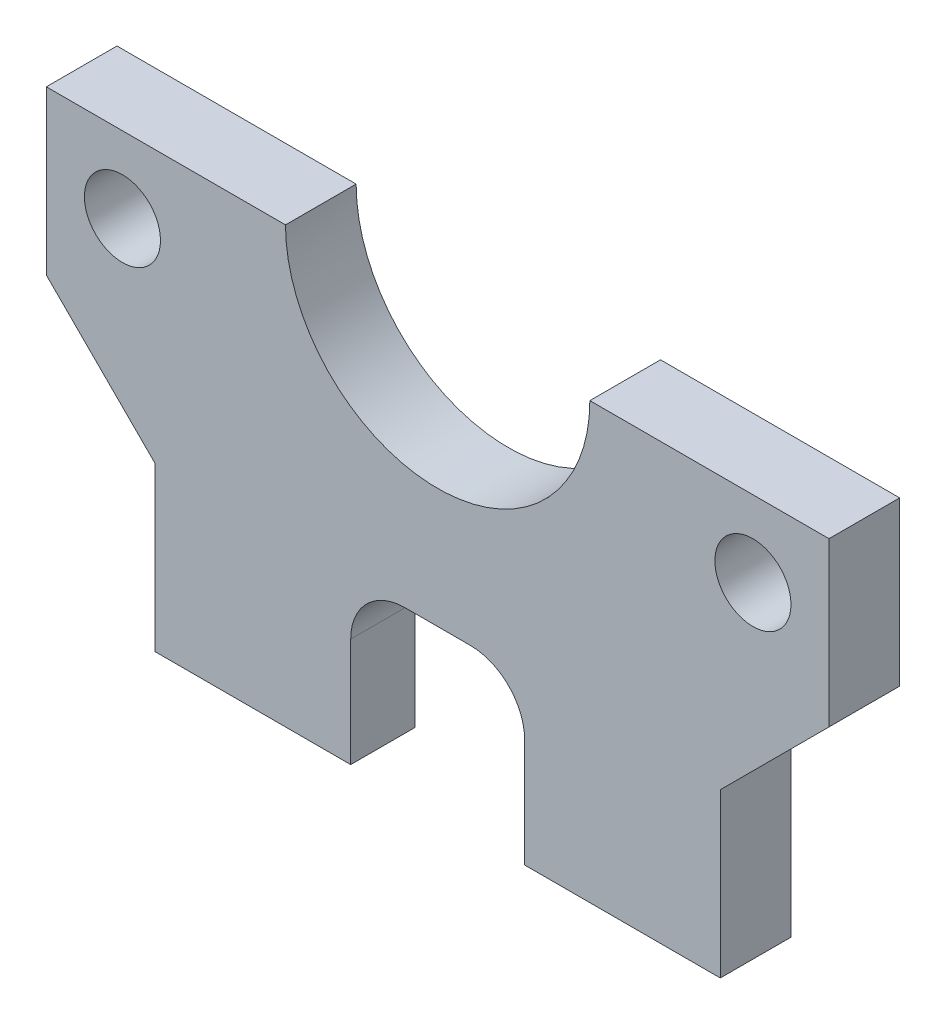
from build123d import *

# Parameters (mm, degrees)
SKETCH1_W           = 52
SKETCH1_H           = 40
BOSS_EXTRUDE1_DEPTH = 6.5
SKETCH10_W          = 10
SKETCH10_H          = 15
BOSS_EXTRUDE2_DEPTH = 6.5
CHAMFER1_SIZE       = 10
CUT_EXTRUDE4_DEPTH  = 25
SKETCH6_R           = 14
CUT_EXTRUDE5_DEPTH  = 10
SKETCH7_R           = 3.5
CUT_EXTRUDE6_DEPTH  = 10
SKETCH8_W           = 0.314102564
SKETCH8_H           = 2.557692308
CUT_EXTRUDE7_DEPTH  = 1
SKETCH9_W           = 16
SKETCH9_H           = 15
CUT_EXTRUDE8_DEPTH  = 10
FILLET1_R           = 5
CUT_EXTRUDE9_DEPTH  = 25


with BuildPart() as part:
    # Sketch1 → Boss-Extrude1 (new body)
    with BuildSketch(Plane.XY):
        Rectangle(SKETCH1_W, SKETCH1_H)
    extrude(amount=BOSS_EXTRUDE1_DEPTH)

    # Sketch10 → Boss-Extrude2 (add)
    with BuildSketch(Plane(origin=(0, 0, 0), x_dir=(-1, 0, 0), z_dir=(0, 0, -1))):
        with Locations((31, 12.5)):
            Rectangle(SKETCH10_W, SKETCH10_H)
        with Locations((-31, 12.5)):
            Rectangle(SKETCH10_W, SKETCH10_H)
    extrude(amount=-BOSS_EXTRUDE2_DEPTH)

    # Chamfer1
    chamfer1_edges = [part.edges().sort_by_distance(p)[0] for p in [
        (26, 5, 3.25),
        (-26, 5, 3.25),
    ]]
    chamfer(chamfer1_edges, length=CHAMFER1_SIZE - 0.0001)  # a hair under: the kernel refuses the full size

    # Sketch5 → Cut-Extrude4 (cut)
    with BuildSketch(Plane.XZ.offset(20)):
        Polygon((-26, 0), (26, 0), (-26, 0.925820442), align=None)
    extrude(amount=-CUT_EXTRUDE4_DEPTH, mode=Mode.SUBTRACT)

    # Sketch6 → Cut-Extrude5 (cut)
    with BuildSketch(Plane.XY.offset(6.5)):
        with Locations((0, 20)):
            Circle(SKETCH6_R)
    extrude(amount=-CUT_EXTRUDE5_DEPTH, mode=Mode.SUBTRACT)

    # Sketch7 → Cut-Extrude6 (cut)
    with BuildSketch(Plane.XY.offset(6.5)):
        with Locations((29, 13)):
            Circle(SKETCH7_R)
        with Locations((-29, 13)):
            Circle(SKETCH7_R)
    extrude(amount=-CUT_EXTRUDE6_DEPTH, mode=Mode.SUBTRACT)

    # Sketch8 → Cut-Extrude7 (cut)
    # profile 1 of 6: a face of its own
    with BuildSketch(Plane.XZ.offset(20)):
        with BuildLine():
            Line((13.448717949, 5.5), (14.149138622, 5.5))
            add(Edge.make_bspline(
                [(14.149138622, 5.5), (14.19587975, 5.499844414), (14.285627895, 5.499545672), (14.414201165, 5.497879909), (14.531028262, 5.493105553), (14.636048101, 5.48899697), (14.729258756, 5.481505028), (14.810946047, 5.474344381), (14.880733745, 5.46497072), (14.922979596, 5.456265297), (14.942107372, 5.452323718)],
                knots=[0, 0, 0, 0, 1.410062039, 2.707475311, 3.878576406, 4.937260626, 5.877586885, 6.699081471, 7.410979367, 8, 8, 8, 8], degree=3))
            add(Edge.make_bspline(
                [(14.942107372, 5.452323718), (14.967713996, 5.445996953), (15.018380985, 5.433478389), (15.091331051, 5.407018788), (15.160845375, 5.376399163), (15.2266352, 5.340435443), (15.288370991, 5.298860663), (15.346689302, 5.252392541), (15.401854765, 5.201285335), (15.451636395, 5.144250494), (15.498575447, 5.084413984), (15.538164073, 5.019710227), (15.572290553, 4.9520487), (15.59946107, 4.880741282), (15.621339044, 4.80647951), (15.636765283, 4.728590713), (15.646016471, 4.647429738), (15.646958326, 4.59207183), (15.647435897, 4.564002404)],
                knots=[0, 0, 0, 0, 1.027469482, 2.033020251, 3.019912614, 3.986113645, 4.951240523, 5.91722682, 6.890402269, 7.87763091, 8.8651537, 9.85103654, 10.82876324, 11.815024772, 12.821070561, 13.842952187, 14.906261191, 16, 16, 16, 16], degree=3))
            add(Edge.make_bspline(
                [(15.647435897, 4.564002404), (15.645966899, 4.517367299), (15.643100504, 4.426370131), (15.6163754, 4.29430925), (15.57259888, 4.171119935), (15.512275591, 4.056957297), (15.435456115, 3.954046652), (15.343131324, 3.863656197), (15.235249713, 3.788016284), (15.134820397, 3.735563479), (15.046106197, 3.701970571), (14.973072884, 3.678334212), (14.893405907, 3.660072247), (14.807868572, 3.643712115), (14.716104917, 3.63136042), (14.618334877, 3.622313826), (14.514488726, 3.616659777), (14.443149656, 3.615817772), (14.406450321, 3.615384615)],
                knots=[0, 0, 0, 0, 1.260483769, 2.459530307, 3.627416485, 4.787058657, 5.939039949, 7.08810263, 8.267026773, 9.491475466, 10.141966685, 10.831826277, 11.566392101, 12.351337768, 13.187381173, 14.07005841, 15.007169909, 16, 16, 16, 16], degree=3))
            Line((14.406450321, 3.615384615), (15.692307692, 2))
            Line((15.692307692, 2), (15.303886218, 2))
            Line((15.303886218, 2), (14.018028846, 3.615384615))
            Line((14.018028846, 3.615384615), (13.762820513, 3.615384615))
            Line((13.762820513, 3.615384615), (13.762820513, 2))
            Line((13.762820513, 2), (13.448717949, 2))
            Line((13.448717949, 2), (13.448717949, 5.5))
        make_face()
        with BuildLine():
            Line((13.762820513, 5.141025641), (13.762820513, 3.974358974))
            Line((13.762820513, 3.974358974), (14.403645833, 3.969451122))
            add(Edge.make_bspline(
                [(14.403645833, 3.969451122), (14.433565872, 3.969437885), (14.491559429, 3.969412229), (14.575460094, 3.973406005), (14.653580206, 3.977949323), (14.725620958, 3.984898669), (14.791614533, 3.99385474), (14.851527947, 4.005057725), (14.905458998, 4.018109787), (14.968357537, 4.038311413), (15.038594068, 4.070317431), (15.114925528, 4.11688293), (15.179927866, 4.175452049), (15.234845728, 4.242425505), (15.27897516, 4.316061754), (15.310087214, 4.395478123), (15.329829656, 4.478669721), (15.332158202, 4.535847829), (15.333333333, 4.564703526)],
                knots=[0, 0, 0, 0, 1.146690395, 2.22261258, 3.21895312, 4.145990853, 4.996080663, 5.770904154, 6.481378293, 7.121626537, 8.300444488, 9.431385265, 10.535395872, 11.636531494, 12.74115979, 13.810798291, 14.895190096, 16, 16, 16, 16], degree=3))
            add(Edge.make_bspline(
                [(15.333333333, 4.564703526), (15.332131212, 4.592850099), (15.329749047, 4.648626338), (15.310300278, 4.730282248), (15.277410897, 4.807349198), (15.233088659, 4.879513683), (15.179089504, 4.945019419), (15.115771691, 5.001066572), (15.044866496, 5.047316037), (14.978595298, 5.076870418), (14.919361085, 5.094990271), (14.867931425, 5.107741435), (14.809819948, 5.117985904), (14.744744489, 5.126193964), (14.672982858, 5.133248909), (14.594172207, 5.138000687), (14.508835427, 5.140814551), (14.449688496, 5.14095364), (14.419070513, 5.141025641)],
                knots=[0, 0, 0, 0, 1.101028733, 2.181837193, 3.264309656, 4.369019818, 5.486613113, 6.575447106, 7.666700264, 8.788928104, 9.402425223, 10.0903467, 10.862060571, 11.710948788, 12.657782767, 13.684531032, 14.801375019, 16, 16, 16, 16], degree=3))
            Line((14.419070513, 5.141025641), (13.762820513, 5.141025641))
        make_face(mode=Mode.SUBTRACT)
    # profile 2 of 6: a face of its own
    with BuildSketch(Plane.XZ.offset(20)):
        with BuildLine():
            add(Edge.make_bspline(
                [(16.431290064, 5.634615385), (16.45078138, 5.633711232), (16.48894912, 5.631940728), (16.544142387, 5.616779251), (16.594399399, 5.591079566), (16.638977132, 5.556599885), (16.677229019, 5.516050441), (16.704009729, 5.468789473), (16.721222126, 5.417730834), (16.723300681, 5.382115745), (16.724358974, 5.363982372)],
                knots=[0, 0, 0, 0, 1.055194115, 2.066272739, 3.074728998, 4.095836921, 5.109056067, 6.073838105, 7.019297344, 8, 8, 8, 8], degree=3))
            add(Edge.make_bspline(
                [(16.724358974, 5.363982372), (16.723276815, 5.346319719), (16.721137513, 5.311402744), (16.704023024, 5.261229272), (16.677000787, 5.214624988), (16.639001661, 5.174154278), (16.5943929, 5.139693658), (16.544144114, 5.113988919), (16.488948666, 5.098828782), (16.450781226, 5.097058093), (16.431290064, 5.096153846)],
                knots=[0, 0, 0, 0, 0.96129708, 1.900370562, 2.859976407, 3.87933698, 4.906634145, 5.921202961, 6.938410037, 8, 8, 8, 8], degree=3))
            add(Edge.make_bspline(
                [(16.431290064, 5.096153846), (16.412021789, 5.097023566), (16.374518609, 5.098716363), (16.320151766, 5.114286381), (16.270323277, 5.139702454), (16.225658604, 5.173928639), (16.188428411, 5.214873536), (16.161330086, 5.26120083), (16.144255124, 5.311409985), (16.142110495, 5.346322151), (16.141025641, 5.363982372)],
                knots=[0, 0, 0, 0, 1.054934014, 2.053291228, 3.073705704, 4.106921865, 5.123545215, 6.088680038, 7.033164197, 8, 8, 8, 8], degree=3))
            add(Edge.make_bspline(
                [(16.141025641, 5.363982372), (16.142086728, 5.382113221), (16.144170769, 5.417723354), (16.161342885, 5.468818387), (16.188202693, 5.515799889), (16.225683256, 5.556825388), (16.270316716, 5.591070823), (16.320153462, 5.616481804), (16.374518161, 5.632053144), (16.412021637, 5.633745758), (16.431290064, 5.634615385)],
                knots=[0, 0, 0, 0, 0.98631895, 1.937192651, 2.907499808, 3.917963147, 4.944918757, 5.95915025, 6.951458133, 8, 8, 8, 8], degree=3))
        make_face()
    # profile 3 of 6: a face of its own
    with BuildSketch(Plane.XZ.offset(20)):
        with Locations((16.432692308, 3.278846154)):
            Rectangle(SKETCH8_W, SKETCH8_H)
    # profile 4 of 6: a face of its own
    with BuildSketch(Plane.XZ.offset(20)):
        with BuildLine():
            Line((19.596153846, 4.557692308), (19.91025641, 4.557692308))
            Line((19.91025641, 4.557692308), (19.91025641, 2.527944712))
            add(Edge.make_bspline(
                [(19.91025641, 2.527944712), (19.909979368, 2.484707117), (19.909444609, 2.401248144), (19.905593638, 2.280569865), (19.89747296, 2.169103779), (19.888264279, 2.06634152), (19.875017563, 1.97275941), (19.858841195, 1.888078206), (19.840605516, 1.812216643), (19.824585299, 1.765491802), (19.817007212, 1.743389423)],
                knots=[0, 0, 0, 0, 1.307562039, 2.523909702, 3.650326591, 4.686913197, 5.643429486, 6.506965704, 7.293745905, 8, 8, 8, 8], degree=3))
            add(Edge.make_bspline(
                [(19.817007212, 1.743389423), (19.805817973, 1.714659501), (19.783774046, 1.658058664), (19.742488413, 1.577824344), (19.696254509, 1.502277954), (19.643447759, 1.431840503), (19.584306955, 1.36686559), (19.520225462, 1.305941591), (19.449955271, 1.250357423), (19.373536559, 1.201072126), (19.292730926, 1.156685072), (19.207584824, 1.118238505), (19.118578385, 1.084751661), (19.024875494, 1.059668865), (18.927945259, 1.037934145), (18.826647828, 1.023789459), (18.721575031, 1.014162401), (18.650129651, 1.013272168), (18.613882212, 1.012820513)],
                knots=[0, 0, 0, 0, 0.981931301, 1.934503488, 2.87077864, 3.801706999, 4.735015492, 5.667491629, 6.616593066, 7.585388521, 8.561939025, 9.551802639, 10.560317337, 11.588439944, 12.640189604, 13.723962949, 14.845264515, 16, 16, 16, 16], degree=3))
            add(Edge.make_bspline(
                [(18.613882212, 1.012820513), (18.560997477, 1.013676999), (18.457699382, 1.015349946), (18.307094389, 1.034840861), (18.164059669, 1.062395234), (18.030485212, 1.104100661), (17.907215116, 1.155137651), (17.79509124, 1.213732604), (17.695120132, 1.280921913), (17.604996459, 1.357422514), (17.523654869, 1.448386195), (17.447127579, 1.555585039), (17.373466637, 1.680651929), (17.330298, 1.772444642), (17.307692308, 1.820512821)],
                knots=[0, 0, 0, 0, 1.157897085, 2.2616841, 3.32207898, 4.345638746, 5.321241055, 6.241986252, 7.112515963, 7.955008012, 8.825025602, 9.77857164, 10.836726669, 12, 12, 12, 12], degree=3))
            Line((17.307692308, 1.820512821), (17.621794872, 1.820512821))
            add(Edge.make_bspline(
                [(17.621794872, 1.820512821), (17.647057081, 1.780406945), (17.69644159, 1.702004896), (17.78879007, 1.60049174), (17.889996397, 1.513738376), (18.00347608, 1.443827602), (18.129701295, 1.39111781), (18.268747982, 1.353542514), (18.421747603, 1.331046247), (18.528265817, 1.328334953), (18.583733974, 1.326923077)],
                knots=[0, 0, 0, 0, 0.997731894, 1.950442991, 2.880492273, 3.800895997, 4.748200782, 5.754801363, 6.83083817, 8, 8, 8, 8], degree=3))
            add(Edge.make_bspline(
                [(18.583733974, 1.326923077), (18.638500865, 1.328353226), (18.744085947, 1.331110409), (18.895917116, 1.353552554), (19.034512054, 1.391125987), (19.159072255, 1.443734374), (19.268128024, 1.50818478), (19.362140015, 1.580184855), (19.438284691, 1.661365858), (19.489497658, 1.736147664), (19.521332275, 1.802771793), (19.541604512, 1.860124389), (19.558078482, 1.924977267), (19.571858319, 1.997113003), (19.583229232, 2.07663466), (19.590432115, 2.163724064), (19.595637926, 2.258183286), (19.595977896, 2.323676424), (19.596153846, 2.357572115)],
                knots=[0, 0, 0, 0, 1.570740765, 3.028230971, 4.391408896, 5.680370741, 6.894727393, 8.017376726, 9.065722033, 10.075533815, 10.603371122, 11.180248986, 11.817768598, 12.521299649, 13.286540596, 14.121245857, 15.027658897, 16, 16, 16, 16], degree=3))
            Line((19.596153846, 2.357572115), (19.596153846, 2.490084135))
            add(Edge.make_bspline(
                [(19.596153846, 2.490084135), (19.564272729, 2.452142332), (19.501071273, 2.376926113), (19.391923946, 2.278364476), (19.27270703, 2.193478346), (19.143623488, 2.123859711), (19.007835246, 2.068178287), (18.866813015, 2.029235326), (18.72182096, 2.004075426), (18.62356881, 2.00136811), (18.573918269, 2)],
                knots=[0, 0, 0, 0, 1.012485704, 2.007162095, 2.997754123, 3.998611389, 4.999708251, 5.992315798, 6.98544096, 8, 8, 8, 8], degree=3))
            add(Edge.make_bspline(
                [(18.573918269, 2), (18.544682, 2.000515026), (18.486555442, 2.001538985), (18.400200695, 2.010497762), (18.315120257, 2.023496504), (18.231512553, 2.042577943), (18.14925694, 2.06706967), (18.068489348, 2.097686409), (17.988555821, 2.132301527), (17.910909323, 2.17307433), (17.836323193, 2.218436637), (17.765360008, 2.267575528), (17.698391468, 2.320233816), (17.636054979, 2.376930756), (17.578432308, 2.437584289), (17.52474844, 2.501547842), (17.475891092, 2.569714583), (17.430857703, 2.640841541), (17.391800153, 2.715402464), (17.357515781, 2.79178056), (17.327706376, 2.869812514), (17.303940974, 2.949759577), (17.285789861, 3.031571346), (17.272279634, 3.115113795), (17.264616702, 3.200644182), (17.263421778, 3.258265532), (17.262820513, 3.287259615)],
                knots=[0, 0, 0, 0, 1.028754217, 2.045334182, 3.052854819, 4.056607503, 5.061168794, 6.071104265, 7.095078842, 8.125279047, 9.155117945, 10.165957491, 11.161587969, 12.151493252, 13.128948131, 14.104219989, 15.088194871, 16.07871515, 17.064853787, 18.047899887, 19.02414258, 20.002704429, 20.980574569, 21.971845993, 22.979467364, 24, 24, 24, 24], degree=3))
            add(Edge.make_bspline(
                [(17.262820513, 3.287259615), (17.263339679, 3.316262711), (17.264376001, 3.37415657), (17.27332698, 3.460035956), (17.28609517, 3.544765391), (17.306302939, 3.627471533), (17.330625461, 3.709096284), (17.360749034, 3.789036741), (17.396967793, 3.86731725), (17.437977543, 3.943995781), (17.484061635, 4.018043396), (17.534594116, 4.088370042), (17.58963599, 4.154458214), (17.648427906, 4.216974636), (17.711687723, 4.275316129), (17.779382715, 4.329341094), (17.850845596, 4.37995512), (17.926297846, 4.426066457), (18.004575234, 4.466848704), (18.083689052, 4.504061301), (18.164687287, 4.53359542), (18.246059826, 4.559618519), (18.329239741, 4.578053715), (18.413207135, 4.592275957), (18.498249473, 4.600940678), (18.555202368, 4.602022263), (18.583733974, 4.602564103)],
                knots=[0, 0, 0, 0, 1.008818848, 2.013730394, 3.001654427, 3.987803273, 4.973046549, 5.963777569, 6.957074694, 7.972068341, 8.987420212, 9.989399531, 10.982630087, 11.977756091, 12.973280677, 13.973972381, 14.989194003, 16.018387222, 17.047741039, 18.059210846, 19.057554164, 20.045176975, 21.029480261, 22.018708529, 23.007435371, 24, 24, 24, 24], degree=3))
            add(Edge.make_bspline(
                [(18.583733974, 4.602564103), (18.630784913, 4.601207429), (18.723696061, 4.598528416), (18.860427063, 4.577507271), (18.992369303, 4.543993258), (19.120267319, 4.495977627), (19.24516297, 4.430427589), (19.366644625, 4.344084641), (19.485063759, 4.236174301), (19.55814159, 4.153421437), (19.596153846, 4.110376603)],
                knots=[0, 0, 0, 0, 0.96728863, 1.910097829, 2.838038873, 3.762875196, 4.71315279, 5.730631239, 6.819562287, 8, 8, 8, 8], degree=3))
            Line((19.596153846, 4.110376603), (19.596153846, 4.557692308))
        make_face()
        with BuildLine():
            add(Edge.make_bspline(
                [(18.608974359, 4.288461538), (18.563043655, 4.286900473), (18.472110601, 4.283809894), (18.338822258, 4.257425181), (18.210145325, 4.216079281), (18.088539897, 4.156936666), (17.974632787, 4.084842428), (17.873557966, 3.99750214), (17.78515305, 3.897755943), (17.710370112, 3.786505696), (17.650838745, 3.666483421), (17.608695326, 3.539972687), (17.581445303, 3.409017694), (17.578437651, 3.319645091), (17.576923077, 3.274639423)],
                knots=[0, 0, 0, 0, 1.026226791, 2.031711442, 3.026614839, 4.04107745, 5.047145931, 6.032893242, 7.017642609, 8.019221815, 9.021877557, 10.003543541, 10.994637589, 12, 12, 12, 12], degree=3))
            add(Edge.make_bspline(
                [(17.576923077, 3.274639423), (17.577648834, 3.240706151), (17.579076185, 3.173969327), (17.592799763, 3.076031432), (17.614980728, 2.982751118), (17.646417934, 2.894122744), (17.685370629, 2.809637949), (17.734363, 2.729878714), (17.792013972, 2.654774008), (17.85787231, 2.584879326), (17.930448692, 2.521218358), (18.009167891, 2.465280317), (18.093923141, 2.419529596), (18.182629951, 2.379988759), (18.277440707, 2.351109691), (18.376989793, 2.329070912), (18.48198149, 2.316462154), (18.553553229, 2.314899356), (18.590044071, 2.314102564)],
                knots=[0, 0, 0, 0, 1.039728707, 2.044842319, 3.024901384, 3.974314358, 4.923051295, 5.871625912, 6.837440708, 7.820715446, 8.810779094, 9.792721783, 10.773906224, 11.758876063, 12.764959493, 13.806266761, 14.881525401, 16, 16, 16, 16], degree=3))
            add(Edge.make_bspline(
                [(18.590044071, 2.314102564), (18.627007829, 2.314870173), (18.699290066, 2.316371224), (18.804861003, 2.329274723), (18.904893743, 2.350096699), (18.999296565, 2.379659725), (19.088425906, 2.417381475), (19.171280521, 2.465118093), (19.249636969, 2.519482525), (19.320993379, 2.582894539), (19.385517544, 2.652779534), (19.441748311, 2.728824429), (19.48966276, 2.809884948), (19.52934043, 2.895951954), (19.559631634, 2.987694307), (19.579950539, 3.084882663), (19.594157284, 3.187051401), (19.595478209, 3.257060018), (19.596153846, 3.29286859)],
                knots=[0, 0, 0, 0, 1.121943988, 2.193949579, 3.223793937, 4.220241907, 5.192961521, 6.155822191, 7.11847367, 8.083710714, 9.04790392, 10.001595906, 10.949595423, 11.902125208, 12.873731292, 13.87582262, 14.913508608, 16, 16, 16, 16], degree=3))
            add(Edge.make_bspline(
                [(19.596153846, 3.29286859), (19.594814278, 3.339486444), (19.592197233, 3.430561349), (19.567500075, 3.563268117), (19.527679865, 3.68803679), (19.471833112, 3.804472766), (19.401851104, 3.911342316), (19.317560255, 4.006666161), (19.220414224, 4.090567017), (19.110692124, 4.160465211), (18.992644679, 4.216930645), (18.869123483, 4.259292417), (18.740311919, 4.283286732), (18.653005509, 4.286726675), (18.608974359, 4.288461538)],
                knots=[0, 0, 0, 0, 1.070913519, 2.092188694, 3.091357305, 4.074328408, 5.051968682, 6.018948707, 6.99050112, 7.9935919, 9.000589572, 9.992915277, 10.987769056, 12, 12, 12, 12], degree=3))
        make_face(mode=Mode.SUBTRACT)
    # profile 5 of 6: a face of its own
    with BuildSketch(Plane.XZ.offset(20)):
        with BuildLine():
            Line((20.628205128, 5.58974359), (20.942307692, 5.58974359))
            Line((20.942307692, 5.58974359), (20.942307692, 4.074619391))
            add(Edge.make_bspline(
                [(20.942307692, 4.074619391), (20.976024994, 4.116763373), (21.041674308, 4.198819866), (21.152170425, 4.305881057), (21.265641297, 4.398679678), (21.386006107, 4.472550135), (21.511056627, 4.530906678), (21.641320271, 4.572294325), (21.776821243, 4.597745421), (21.868846393, 4.600943839), (21.915464744, 4.602564103)],
                knots=[0, 0, 0, 0, 1.125788106, 2.19196713, 3.20547328, 4.180437432, 5.132270164, 6.079753143, 7.027236121, 8, 8, 8, 8], degree=3))
            add(Edge.make_bspline(
                [(21.915464744, 4.602564103), (21.962795136, 4.600818672), (22.055432132, 4.597402444), (22.190313595, 4.570389063), (22.31627447, 4.524231625), (22.432940312, 4.4610646), (22.537765009, 4.382391773), (22.630614774, 4.29156025), (22.706455572, 4.186286332), (22.758054689, 4.089030078), (22.791628097, 4.002491324), (22.812879924, 3.928254812), (22.830899122, 3.845532899), (22.846598858, 3.754368166), (22.857062439, 3.654322995), (22.865467057, 3.545848741), (22.871443511, 3.428951622), (22.871675116, 3.348031373), (22.871794872, 3.306189904)],
                knots=[0, 0, 0, 0, 1.235656852, 2.418478516, 3.575258207, 4.727955599, 5.870717718, 6.98870536, 8.107142894, 9.245821548, 9.854588956, 10.528768408, 11.260415777, 12.065282286, 12.943670737, 13.886611085, 14.907229059, 16, 16, 16, 16], degree=3))
            Line((22.871794872, 3.306189904), (22.871794872, 2))
            Line((22.871794872, 2), (22.557692308, 2))
            Line((22.557692308, 2), (22.557692308, 3.203125))
            add(Edge.make_bspline(
                [(22.557692308, 3.203125), (22.557502005, 3.23794767), (22.557137987, 3.30455751), (22.555934642, 3.399923618), (22.553248427, 3.486419753), (22.548907601, 3.563768705), (22.544342294, 3.632078308), (22.538058977, 3.691249362), (22.530748743, 3.741363138), (22.524179961, 3.771527766), (22.521233974, 3.78505609)],
                knots=[0, 0, 0, 0, 1.430932559, 2.737130458, 3.918967929, 4.986496826, 5.920444988, 6.731744033, 7.431208747, 8, 8, 8, 8], degree=3))
            add(Edge.make_bspline(
                [(22.521233974, 3.78505609), (22.509809729, 3.824750353), (22.487846685, 3.901062344), (22.436798707, 4.004724754), (22.373039696, 4.093109495), (22.295192435, 4.165023783), (22.204634071, 4.221435322), (22.100774107, 4.260503105), (21.984590038, 4.284750827), (21.902738566, 4.28719013), (21.860076122, 4.288461538)],
                knots=[0, 0, 0, 0, 1.090059168, 2.095632401, 3.037101401, 3.955032261, 4.878929692, 5.839099886, 6.873700383, 8, 8, 8, 8], degree=3))
            add(Edge.make_bspline(
                [(21.860076122, 4.288461538), (21.834808349, 4.287985712), (21.784804078, 4.287044064), (21.710655413, 4.277590166), (21.638726349, 4.262141447), (21.568324171, 4.241236908), (21.500940973, 4.212791372), (21.434612648, 4.179861183), (21.37121844, 4.139552928), (21.309632623, 4.09432716), (21.252315089, 4.0442574), (21.198987974, 3.991410445), (21.151449634, 3.935135481), (21.108381043, 3.876335365), (21.071202757, 3.814203572), (21.038749675, 3.749339253), (21.011213979, 3.681657108), (20.997531286, 3.634682046), (20.990685096, 3.611177885)],
                knots=[0, 0, 0, 0, 1.024319606, 2.027102035, 3.025350316, 4.005802111, 5.00026367, 5.987881639, 7.005602596, 8.042517216, 9.083927026, 10.089214625, 11.084353441, 12.06828073, 13.041928858, 14.016821737, 15.00770877, 16, 16, 16, 16], degree=3))
            add(Edge.make_bspline(
                [(20.990685096, 3.611177885), (20.986745669, 3.594156934), (20.978161172, 3.557066187), (20.968846339, 3.495891863), (20.960508542, 3.424805491), (20.953459992, 3.34391489), (20.949136906, 3.252923648), (20.944478665, 3.152452689), (20.942744651, 3.041872668), (20.942457698, 2.964977161), (20.942307692, 2.924779647)],
                knots=[0, 0, 0, 0, 0.607992626, 1.324890765, 2.152360218, 3.099583803, 4.150613268, 5.323148443, 6.60066238, 8, 8, 8, 8], degree=3))
            Line((20.942307692, 2.924779647), (20.942307692, 2))
            Line((20.942307692, 2), (20.628205128, 2))
            Line((20.628205128, 2), (20.628205128, 5.58974359))
        make_face()
    # profile 6 of 6: a face of its own
    with BuildSketch(Plane.XZ.offset(20)):
        Polygon((23.903846154, 5.58974359), (24.217948718, 5.58974359), (24.217948718, 4.557692308), (24.666666667, 4.557692308), (24.666666667, 4.243589744), (24.217948718, 4.243589744), (24.217948718, 2), (23.903846154, 2), (23.903846154, 4.243589744), (23.455128205, 4.243589744), (23.455128205, 4.557692308), (23.903846154, 4.557692308), align=None)
    extrude(amount=-CUT_EXTRUDE7_DEPTH, mode=Mode.SUBTRACT)

    # Sketch9 → Cut-Extrude8 (cut)
    with BuildSketch(Plane.XY.offset(6.5)):
        with Locations((0, -12.5)):
            Rectangle(SKETCH9_W, SKETCH9_H)
    extrude(amount=-CUT_EXTRUDE8_DEPTH, mode=Mode.SUBTRACT)

    # Fillet1
    fillet1_edges = [part.edges().sort_by_distance(p)[0] for p in [
        (8, -5, 3.410238153),
        (-8, -5, 3.552672068),
    ]]
    fillet(fillet1_edges, radius=FILLET1_R)

    # Sketch11 → Cut-Extrude9 (cut)
    with BuildSketch(Plane.XZ.offset(20)):
        Polygon((-26, 0.925820442), (-36, 1.103862835), (-36, 0), (-26, 0), align=None)
    extrude(amount=-CUT_EXTRUDE9_DEPTH, mode=Mode.SUBTRACT)


solid = part.part
